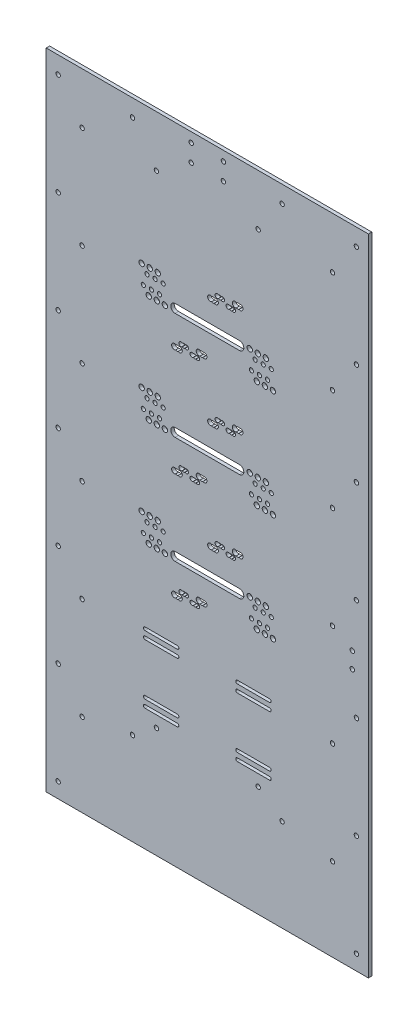
from build123d import *

# Parameters (mm, degrees)
SKETCH1_W           = 300
SKETCH1_H           = 600
BOSS_EXTRUDE1_DEPTH = 3.175
CUT_EXTRUDE1_DEPTH  = 10
SKETCH5_R           = 2.5
SKETCH5_R_2         = 1.95
CUT_EXTRUDE4_DEPTH  = 10
SKETCH6_R           = 2.05
CUT_EXTRUDE5_DEPTH  = 51
CUT_EXTRUDE6_DEPTH  = 51
SKETCH8_R           = 2.1
CUT_EXTRUDE7_DEPTH  = 67
SKETCH9_R           = 2.05
CUT_EXTRUDE8_DEPTH  = 10


with BuildPart() as part:
    # Sketch1 → Boss-Extrude1 (new body)
    with BuildSketch(Plane.XY):
        with Locations((-15.986837609, 103.602194644)):
            Rectangle(SKETCH1_W, SKETCH1_H)
    extrude(amount=BOSS_EXTRUDE1_DEPTH)

    # Sketch4 → Cut-Extrude1 (cut)
    with BuildSketch(Plane.XY.offset(3.175)):
        with BuildLine():
            Line((-45.986837609, 257.602194644), (14.013162391, 257.602194644))
            ThreePointArc((14.013162391, 257.602194644), (18.013162391, 253.602194644), (14.013162391, 249.602194644))
            Line((14.013162391, 249.602194644), (-45.986837609, 249.602194644))
            ThreePointArc((-45.986837609, 249.602194644), (-49.986837609, 253.602194644), (-45.986837609, 257.602194644))
        make_face()
        with BuildLine():
            Line((-45.986837609, 157.602194644), (14.013162391, 157.602194644))
            ThreePointArc((14.013162391, 157.602194644), (18.013162391, 153.602194644), (14.013162391, 149.602194644))
            Line((14.013162391, 149.602194644), (-45.986837609, 149.602194644))
            ThreePointArc((-45.986837609, 149.602194644), (-49.986837609, 153.602194644), (-45.986837609, 157.602194644))
        make_face()
        with BuildLine():
            Line((-45.986837609, 57.602194644), (14.013162391, 57.602194644))
            ThreePointArc((14.013162391, 57.602194644), (18.013162391, 53.602194644), (14.013162391, 49.602194644))
            Line((14.013162391, 49.602194644), (-45.986837609, 49.602194644))
            ThreePointArc((-45.986837609, 49.602194644), (-49.986837609, 53.602194644), (-45.986837609, 57.602194644))
        make_face()
    extrude(amount=-CUT_EXTRUDE1_DEPTH, mode=Mode.SUBTRACT)

    # Sketch5 → Cut-Extrude4 (cut)
    with BuildSketch(Plane(origin=(0, 0, 0), x_dir=(-1, 0, 0), z_dir=(0, 0, -1))):
        with Locations((-30.126255431, 32.82022594)):
            Circle(SKETCH5_R)
        with Locations((-37.626255431, 32.82022594)):
            Circle(SKETCH5_R)
        with Locations((-45.126255431, 32.82022594)):
            Circle(SKETCH5_R)
        with Locations((-32.60242235, 39.116594733)):
            Circle(SKETCH5_R_2)
        with Locations((-25.10242235, 39.116594733)):
            Circle(SKETCH5_R_2)
        with Locations((-40.10242235, 39.116594733)):
            Circle(SKETCH5_R_2)
        with Locations((-36.067244746, 49.474446333)):
            Circle(SKETCH5_R_2)
        with Locations((-28.567244746, 49.474446333)):
            Circle(SKETCH5_R_2)
        with Locations((-43.567244746, 49.474446333)):
            Circle(SKETCH5_R_2)
        with Locations((-38.543411665, 55.770815126)):
            Circle(SKETCH5_R)
        with Locations((-31.043411665, 55.770815126)):
            Circle(SKETCH5_R)
        with Locations((-23.543411665, 55.770815126)):
            Circle(SKETCH5_R)
        with Locations((62.09993065, 74.384163348)):
            Circle(SKETCH5_R)
        with Locations((69.59993065, 74.384163348)):
            Circle(SKETCH5_R)
        with Locations((77.09993065, 74.384163348)):
            Circle(SKETCH5_R)
        with Locations((57.076097569, 68.087794555)):
            Circle(SKETCH5_R_2)
        with Locations((64.576097569, 68.087794555)):
            Circle(SKETCH5_R_2)
        with Locations((72.076097569, 68.087794555)):
            Circle(SKETCH5_R_2)
        with Locations((60.540919965, 57.729942956)):
            Circle(SKETCH5_R_2)
        with Locations((68.040919965, 57.729942956)):
            Circle(SKETCH5_R_2)
        with Locations((75.540919965, 57.729942956)):
            Circle(SKETCH5_R_2)
        with Locations((70.517086884, 51.433574163)):
            Circle(SKETCH5_R)
        with Locations((63.017086884, 51.433574163)):
            Circle(SKETCH5_R)
        with Locations((55.517086884, 51.433574163)):
            Circle(SKETCH5_R)
        with Locations((-30.126255431, 132.82022594)):
            Circle(SKETCH5_R)
        with Locations((-37.626255431, 132.82022594)):
            Circle(SKETCH5_R)
        with Locations((-45.126255431, 132.82022594)):
            Circle(SKETCH5_R)
        with Locations((-32.60242235, 139.116594733)):
            Circle(SKETCH5_R_2)
        with Locations((-25.10242235, 139.116594733)):
            Circle(SKETCH5_R_2)
        with Locations((-40.10242235, 139.116594733)):
            Circle(SKETCH5_R_2)
        with Locations((-36.067244746, 149.474446333)):
            Circle(SKETCH5_R_2)
        with Locations((-28.567244746, 149.474446333)):
            Circle(SKETCH5_R_2)
        with Locations((-43.567244746, 149.474446333)):
            Circle(SKETCH5_R_2)
        with Locations((-38.543411665, 155.770815126)):
            Circle(SKETCH5_R)
        with Locations((-31.043411665, 155.770815126)):
            Circle(SKETCH5_R)
        with Locations((-23.543411665, 155.770815126)):
            Circle(SKETCH5_R)
        with Locations((62.09993065, 174.384163348)):
            Circle(SKETCH5_R)
        with Locations((69.59993065, 174.384163348)):
            Circle(SKETCH5_R)
        with Locations((77.09993065, 174.384163348)):
            Circle(SKETCH5_R)
        with Locations((57.076097569, 168.087794555)):
            Circle(SKETCH5_R_2)
        with Locations((64.576097569, 168.087794555)):
            Circle(SKETCH5_R_2)
        with Locations((72.076097569, 168.087794555)):
            Circle(SKETCH5_R_2)
        with Locations((60.540919965, 157.729942956)):
            Circle(SKETCH5_R_2)
        with Locations((68.040919965, 157.729942956)):
            Circle(SKETCH5_R_2)
        with Locations((75.540919965, 157.729942956)):
            Circle(SKETCH5_R_2)
        with Locations((70.517086884, 151.433574163)):
            Circle(SKETCH5_R)
        with Locations((63.017086884, 151.433574163)):
            Circle(SKETCH5_R)
        with Locations((55.517086884, 151.433574163)):
            Circle(SKETCH5_R)
        with Locations((-30.126255431, 232.82022594)):
            Circle(SKETCH5_R)
        with Locations((-37.626255431, 232.82022594)):
            Circle(SKETCH5_R)
        with Locations((-45.126255431, 232.82022594)):
            Circle(SKETCH5_R)
        with Locations((-32.60242235, 239.116594733)):
            Circle(SKETCH5_R_2)
        with Locations((-25.10242235, 239.116594733)):
            Circle(SKETCH5_R_2)
        with Locations((-40.10242235, 239.116594733)):
            Circle(SKETCH5_R_2)
        with Locations((-36.067244746, 249.474446333)):
            Circle(SKETCH5_R_2)
        with Locations((-28.567244746, 249.474446333)):
            Circle(SKETCH5_R_2)
        with Locations((-43.567244746, 249.474446333)):
            Circle(SKETCH5_R_2)
        with Locations((-38.543411665, 255.770815126)):
            Circle(SKETCH5_R)
        with Locations((-31.043411665, 255.770815126)):
            Circle(SKETCH5_R)
        with Locations((-23.543411665, 255.770815126)):
            Circle(SKETCH5_R)
        with Locations((62.09993065, 274.384163348)):
            Circle(SKETCH5_R)
        with Locations((69.59993065, 274.384163348)):
            Circle(SKETCH5_R)
        with Locations((77.09993065, 274.384163348)):
            Circle(SKETCH5_R)
        with Locations((57.076097569, 268.087794555)):
            Circle(SKETCH5_R_2)
        with Locations((64.576097569, 268.087794555)):
            Circle(SKETCH5_R_2)
        with Locations((72.076097569, 268.087794555)):
            Circle(SKETCH5_R_2)
        with Locations((60.540919965, 257.729942956)):
            Circle(SKETCH5_R_2)
        with Locations((68.040919965, 257.729942956)):
            Circle(SKETCH5_R_2)
        with Locations((75.540919965, 257.729942956)):
            Circle(SKETCH5_R_2)
        with Locations((70.517086884, 251.433574163)):
            Circle(SKETCH5_R)
        with Locations((63.017086884, 251.433574163)):
            Circle(SKETCH5_R)
        with Locations((55.517086884, 251.433574163)):
            Circle(SKETCH5_R)
        with BuildLine():
            ThreePointArc((-11.035122677, 86.887033976), (-12.285122677, 87.221970467), (-13.535122677, 86.887033976))
            ThreePointArc((-13.535122677, 86.887033976), (-17.285122677, 84.721970467), (-13.535122677, 82.556906957))
            ThreePointArc((-13.535122677, 82.556906957), (-12.285122677, 82.221970467), (-11.035122677, 82.556906957))
            ThreePointArc((-11.035122677, 82.556906957), (-7.285122677, 84.721970467), (-11.035122677, 86.887033976))
        make_face()
        with BuildLine():
            ThreePointArc((20.06032723, 26.907580641), (21.31032723, 26.572644151), (22.56032723, 26.907580641))
            ThreePointArc((22.56032723, 26.907580641), (26.31032723, 29.072644151), (22.56032723, 31.23770766))
            ThreePointArc((22.56032723, 31.23770766), (21.31032723, 31.572644151), (20.06032723, 31.23770766))
            ThreePointArc((20.06032723, 31.23770766), (16.31032723, 29.072644151), (20.06032723, 26.907580641))
        make_face()
        with BuildLine():
            ThreePointArc((26.355079811, 25.543449103), (23.155079811, 24.046786149), (26.355079811, 22.550123194))
            ThreePointArc((26.355079811, 22.550123194), (27.605079811, 22.096786149), (28.855079811, 22.550123194))
            ThreePointArc((28.855079811, 22.550123194), (32.055079811, 24.046786149), (28.855079811, 25.543449103))
            ThreePointArc((28.855079811, 25.543449103), (27.605079811, 25.996786149), (26.355079811, 25.543449103))
        make_face()
        with BuildLine():
            ThreePointArc((39.214045315, 26.011613861), (42.414045315, 27.508276815), (39.214045315, 29.00493977))
            ThreePointArc((39.214045315, 29.00493977), (37.964045315, 29.458276815), (36.714045315, 29.00493977))
            ThreePointArc((36.714045315, 29.00493977), (33.514045315, 27.508276815), (36.714045315, 26.011613861))
            ThreePointArc((36.714045315, 26.011613861), (37.964045315, 25.558276815), (39.214045315, 26.011613861))
        make_face()
        with BuildLine():
            ThreePointArc((43.008797896, 24.647482322), (39.258797896, 22.482418813), (43.008797896, 20.317355304))
            ThreePointArc((43.008797896, 20.317355304), (44.258797896, 19.982418813), (45.508797896, 20.317355304))
            ThreePointArc((45.508797896, 20.317355304), (49.258797896, 22.482418813), (45.508797896, 24.647482322))
            ThreePointArc((45.508797896, 24.647482322), (44.258797896, 24.982418813), (43.008797896, 24.647482322))
        make_face()
        with BuildLine():
            ThreePointArc((-7.240370096, 81.192775404), (-10.440370091, 79.696112456), (-7.240370096, 78.199449508))
            ThreePointArc((-7.240370096, 78.199449508), (-5.990370095, 77.746112461), (-4.740370094, 78.199449509))
            ThreePointArc((-4.740370094, 78.199449509), (-1.540370099, 79.696112464), (-4.7403701, 81.192775407))
            ThreePointArc((-4.7403701, 81.192775407), (-5.990370098, 81.646112451), (-7.240370096, 81.192775404))
        make_face()
        with BuildLine():
            ThreePointArc((3.118595408, 84.654266079), (-0.081404587, 83.157603131), (3.118595408, 81.660940183))
            ThreePointArc((3.118595408, 81.660940183), (4.368595408, 81.207603136), (5.618595408, 81.660940183))
            ThreePointArc((5.618595408, 81.660940183), (8.818595403, 83.157603131), (5.618595408, 84.654266079))
            ThreePointArc((5.618595408, 84.654266079), (4.368595408, 85.107603126), (3.118595408, 84.654266079))
        make_face()
        with BuildLine():
            ThreePointArc((9.413347989, 80.29680863), (5.663347989, 78.13174512), (9.413347989, 75.966681611))
            ThreePointArc((9.413347989, 75.966681611), (10.663347989, 75.63174512), (11.913347989, 75.966681611))
            ThreePointArc((11.913347989, 75.966681611), (15.663347989, 78.13174512), (11.913347989, 80.29680863))
            ThreePointArc((11.913347989, 80.29680863), (10.663347989, 80.63174512), (9.413347989, 80.29680863))
        make_face()
        with BuildLine():
            ThreePointArc((-11.035122677, 186.887033976), (-12.285122677, 187.221970467), (-13.535122677, 186.887033976))
            ThreePointArc((-13.535122677, 186.887033976), (-17.285122677, 184.721970467), (-13.535122677, 182.556906957))
            ThreePointArc((-13.535122677, 182.556906957), (-12.285122677, 182.221970467), (-11.035122677, 182.556906957))
            ThreePointArc((-11.035122677, 182.556906957), (-7.285122677, 184.721970467), (-11.035122677, 186.887033976))
        make_face()
        with BuildLine():
            ThreePointArc((20.06032723, 126.907580641), (21.31032723, 126.572644151), (22.56032723, 126.907580641))
            ThreePointArc((22.56032723, 126.907580641), (26.31032723, 129.072644151), (22.56032723, 131.23770766))
            ThreePointArc((22.56032723, 131.23770766), (21.31032723, 131.572644151), (20.06032723, 131.23770766))
            ThreePointArc((20.06032723, 131.23770766), (16.31032723, 129.072644151), (20.06032723, 126.907580641))
        make_face()
        with BuildLine():
            ThreePointArc((26.355079811, 125.543449103), (23.155079811, 124.046786149), (26.355079811, 122.550123194))
            ThreePointArc((26.355079811, 122.550123194), (27.605079811, 122.096786149), (28.855079811, 122.550123194))
            ThreePointArc((28.855079811, 122.550123194), (32.055079811, 124.046786149), (28.855079811, 125.543449103))
            ThreePointArc((28.855079811, 125.543449103), (27.605079811, 125.996786149), (26.355079811, 125.543449103))
        make_face()
        with BuildLine():
            ThreePointArc((39.214045315, 126.011613861), (42.414045315, 127.508276815), (39.214045315, 129.00493977))
            ThreePointArc((39.214045315, 129.00493977), (37.964045315, 129.458276815), (36.714045315, 129.00493977))
            ThreePointArc((36.714045315, 129.00493977), (33.514045315, 127.508276815), (36.714045315, 126.011613861))
            ThreePointArc((36.714045315, 126.011613861), (37.964045315, 125.558276815), (39.214045315, 126.011613861))
        make_face()
        with BuildLine():
            ThreePointArc((43.008797896, 124.647482322), (39.258797896, 122.482418813), (43.008797896, 120.317355304))
            ThreePointArc((43.008797896, 120.317355304), (44.258797896, 119.982418813), (45.508797896, 120.317355304))
            ThreePointArc((45.508797896, 120.317355304), (49.258797896, 122.482418813), (45.508797896, 124.647482322))
            ThreePointArc((45.508797896, 124.647482322), (44.258797896, 124.982418813), (43.008797896, 124.647482322))
        make_face()
        with BuildLine():
            ThreePointArc((-7.240370096, 181.192775404), (-10.440370091, 179.696112456), (-7.240370096, 178.199449508))
            ThreePointArc((-7.240370096, 178.199449508), (-5.990370095, 177.746112461), (-4.740370094, 178.199449509))
            ThreePointArc((-4.740370094, 178.199449509), (-1.540370099, 179.696112464), (-4.7403701, 181.192775407))
            ThreePointArc((-4.7403701, 181.192775407), (-5.990370098, 181.646112451), (-7.240370096, 181.192775404))
        make_face()
        with BuildLine():
            ThreePointArc((3.118595408, 184.654266079), (-0.081404587, 183.157603131), (3.118595408, 181.660940183))
            ThreePointArc((3.118595408, 181.660940183), (4.368595408, 181.207603136), (5.618595408, 181.660940183))
            ThreePointArc((5.618595408, 181.660940183), (8.818595403, 183.157603131), (5.618595408, 184.654266079))
            ThreePointArc((5.618595408, 184.654266079), (4.368595408, 185.107603126), (3.118595408, 184.654266079))
        make_face()
        with BuildLine():
            ThreePointArc((9.413347989, 180.29680863), (5.663347989, 178.13174512), (9.413347989, 175.966681611))
            ThreePointArc((9.413347989, 175.966681611), (10.663347989, 175.63174512), (11.913347989, 175.966681611))
            ThreePointArc((11.913347989, 175.966681611), (15.663347989, 178.13174512), (11.913347989, 180.29680863))
            ThreePointArc((11.913347989, 180.29680863), (10.663347989, 180.63174512), (9.413347989, 180.29680863))
        make_face()
        with BuildLine():
            ThreePointArc((-11.035122677, 286.887033976), (-12.285122677, 287.221970467), (-13.535122677, 286.887033976))
            ThreePointArc((-13.535122677, 286.887033976), (-17.285122677, 284.721970467), (-13.535122677, 282.556906957))
            ThreePointArc((-13.535122677, 282.556906957), (-12.285122677, 282.221970467), (-11.035122677, 282.556906957))
            ThreePointArc((-11.035122677, 282.556906957), (-7.285122677, 284.721970467), (-11.035122677, 286.887033976))
        make_face()
        with BuildLine():
            ThreePointArc((20.06032723, 226.907580641), (21.31032723, 226.572644151), (22.56032723, 226.907580641))
            ThreePointArc((22.56032723, 226.907580641), (26.31032723, 229.072644151), (22.56032723, 231.23770766))
            ThreePointArc((22.56032723, 231.23770766), (21.31032723, 231.572644151), (20.06032723, 231.23770766))
            ThreePointArc((20.06032723, 231.23770766), (16.31032723, 229.072644151), (20.06032723, 226.907580641))
        make_face()
        with BuildLine():
            ThreePointArc((26.355079811, 225.543449103), (23.155079811, 224.046786149), (26.355079811, 222.550123194))
            ThreePointArc((26.355079811, 222.550123194), (27.605079811, 222.096786149), (28.855079811, 222.550123194))
            ThreePointArc((28.855079811, 222.550123194), (32.055079811, 224.046786149), (28.855079811, 225.543449103))
            ThreePointArc((28.855079811, 225.543449103), (27.605079811, 225.996786149), (26.355079811, 225.543449103))
        make_face()
        with BuildLine():
            ThreePointArc((39.214045315, 226.011613861), (42.414045315, 227.508276815), (39.214045315, 229.00493977))
            ThreePointArc((39.214045315, 229.00493977), (37.964045315, 229.458276815), (36.714045315, 229.00493977))
            ThreePointArc((36.714045315, 229.00493977), (33.514045315, 227.508276815), (36.714045315, 226.011613861))
            ThreePointArc((36.714045315, 226.011613861), (37.964045315, 225.558276815), (39.214045315, 226.011613861))
        make_face()
        with BuildLine():
            ThreePointArc((43.008797896, 224.647482322), (39.258797896, 222.482418813), (43.008797896, 220.317355304))
            ThreePointArc((43.008797896, 220.317355304), (44.258797896, 219.982418813), (45.508797896, 220.317355304))
            ThreePointArc((45.508797896, 220.317355304), (49.258797896, 222.482418813), (45.508797896, 224.647482322))
            ThreePointArc((45.508797896, 224.647482322), (44.258797896, 224.982418813), (43.008797896, 224.647482322))
        make_face()
        with BuildLine():
            ThreePointArc((-7.240370096, 281.192775404), (-10.440370091, 279.696112456), (-7.240370096, 278.199449508))
            ThreePointArc((-7.240370096, 278.199449508), (-5.990370095, 277.746112461), (-4.740370094, 278.199449509))
            ThreePointArc((-4.740370094, 278.199449509), (-1.540370099, 279.696112464), (-4.7403701, 281.192775407))
            ThreePointArc((-4.7403701, 281.192775407), (-5.990370098, 281.646112451), (-7.240370096, 281.192775404))
        make_face()
        with BuildLine():
            ThreePointArc((3.118595408, 284.654266079), (-0.081404587, 283.157603131), (3.118595408, 281.660940183))
            ThreePointArc((3.118595408, 281.660940183), (4.368595408, 281.207603136), (5.618595408, 281.660940183))
            ThreePointArc((5.618595408, 281.660940183), (8.818595403, 283.157603131), (5.618595408, 284.654266079))
            ThreePointArc((5.618595408, 284.654266079), (4.368595408, 285.107603126), (3.118595408, 284.654266079))
        make_face()
        with BuildLine():
            ThreePointArc((9.413347989, 280.29680863), (5.663347989, 278.13174512), (9.413347989, 275.966681611))
            ThreePointArc((9.413347989, 275.966681611), (10.663347989, 275.63174512), (11.913347989, 275.966681611))
            ThreePointArc((11.913347989, 275.966681611), (15.663347989, 278.13174512), (11.913347989, 280.29680863))
            ThreePointArc((11.913347989, 280.29680863), (10.663347989, 280.63174512), (9.413347989, 280.29680863))
        make_face()
    extrude(amount=-CUT_EXTRUDE4_DEPTH, mode=Mode.SUBTRACT)

    # Sketch6 → Cut-Extrude5 (cut)
    with BuildSketch(Plane(origin=(0, 0, 0), x_dir=(-1, 0, 0), z_dir=(0, 0, -1))):
        with Locations((0.986837609, 394.602194644)):
            Circle(SKETCH6_R)
        with Locations((30.986837609, 394.602194644)):
            Circle(SKETCH6_R)
        with Locations((30.986837609, 378.602194644)):
            Circle(SKETCH6_R)
        with Locations((0.986837609, 378.602194644)):
            Circle(SKETCH6_R)
    extrude(amount=-CUT_EXTRUDE5_DEPTH, mode=Mode.SUBTRACT)

    # Sketch7 → Cut-Extrude6 (cut)
    with BuildSketch(Plane(origin=(0, 0, 0), x_dir=(-1, 0, 0), z_dir=(0, 0, -1))):
        with BuildLine():
            Line((-42.013162391, -24.550253951), (-12.013162391, -24.550253951))
            ThreePointArc((-12.013162391, -24.550253951), (-10.513162391, -26.050253951), (-12.013162391, -27.550253951))
            Line((-12.013162391, -27.550253951), (-42.013162391, -27.550253951))
            ThreePointArc((-42.013162391, -27.550253951), (-43.513162391, -26.050253951), (-42.013162391, -24.550253951))
        make_face()
        with BuildLine():
            Line((-42.013162391, -17.24179585), (-12.013162391, -17.24179585))
            ThreePointArc((-12.013162391, -17.24179585), (-10.513162391, -18.74179585), (-12.013162391, -20.24179585))
            Line((-12.013162391, -20.24179585), (-42.013162391, -20.24179585))
            ThreePointArc((-42.013162391, -20.24179585), (-43.513162391, -18.74179585), (-42.013162391, -17.24179585))
        make_face()
        with BuildLine():
            Line((43.986837609, -24.550253951), (73.986837609, -24.550253951))
            ThreePointArc((73.986837609, -24.550253951), (75.486837609, -26.050253951), (73.986837609, -27.550253951))
            Line((73.986837609, -27.550253951), (43.986837609, -27.550253951))
            ThreePointArc((43.986837609, -27.550253951), (42.486837609, -26.050253951), (43.986837609, -24.550253951))
        make_face()
        with BuildLine():
            Line((43.986837609, -17.24179585), (73.986837609, -17.24179585))
            ThreePointArc((73.986837609, -17.24179585), (75.486837609, -18.74179585), (73.986837609, -20.24179585))
            Line((73.986837609, -20.24179585), (43.986837609, -20.24179585))
            ThreePointArc((43.986837609, -20.24179585), (42.486837609, -18.74179585), (43.986837609, -17.24179585))
        make_face()
        with BuildLine():
            Line((43.986837609, -79.858712053), (73.986837609, -79.858712053))
            ThreePointArc((73.986837609, -79.858712053), (75.486837609, -81.358712053), (73.986837609, -82.858712053))
            Line((73.986837609, -82.858712053), (43.986837609, -82.858712053))
            ThreePointArc((43.986837609, -82.858712053), (42.486837609, -81.358712053), (43.986837609, -79.858712053))
        make_face()
        with BuildLine():
            Line((43.986837609, -72.550253951), (73.986837609, -72.550253951))
            ThreePointArc((73.986837609, -72.550253951), (75.486837609, -74.050253951), (73.986837609, -75.550253951))
            Line((73.986837609, -75.550253951), (43.986837609, -75.550253951))
            ThreePointArc((43.986837609, -75.550253951), (42.486837609, -74.050253951), (43.986837609, -72.550253951))
        make_face()
        with BuildLine():
            Line((-42.013162391, -79.858712053), (-12.013162391, -79.858712053))
            ThreePointArc((-12.013162391, -79.858712053), (-10.513162391, -81.358712053), (-12.013162391, -82.858712053))
            Line((-12.013162391, -82.858712053), (-42.013162391, -82.858712053))
            ThreePointArc((-42.013162391, -82.858712053), (-43.513162391, -81.358712053), (-42.013162391, -79.858712053))
        make_face()
        with BuildLine():
            Line((-42.013162391, -72.550253951), (-12.013162391, -72.550253951))
            ThreePointArc((-12.013162391, -72.550253951), (-10.513162391, -74.050253951), (-12.013162391, -75.550253951))
            Line((-12.013162391, -75.550253951), (-42.013162391, -75.550253951))
            ThreePointArc((-42.013162391, -75.550253951), (-43.513162391, -74.050253951), (-42.013162391, -72.550253951))
        make_face()
    extrude(amount=-CUT_EXTRUDE6_DEPTH, mode=Mode.SUBTRACT)

    # Sketch8 → Cut-Extrude7 (cut)
    with BuildSketch(Plane(origin=(0, 0, 0), x_dir=(-1, 0, 0), z_dir=(0, 0, -1))):
        with Locations((-119.013162391, 60.107185306)):
            Circle(SKETCH8_R)
        with Locations((-119.013162391, 45.107185306)):
            Circle(SKETCH8_R)
    extrude(amount=-CUT_EXTRUDE7_DEPTH, mode=Mode.SUBTRACT)

    # Sketch9 → Cut-Extrude8 (cut)
    with BuildSketch(Plane(origin=(0, 0, 0), x_dir=(-1, 0, 0), z_dir=(0, 0, -1))):
        with Locations((-122.874578489, 387.723317654)):
            Circle(SKETCH9_R)
        with Locations((-100.597410687, 355.965563673)):
            Circle(SKETCH9_R)
        with Locations((-53.648179996, 387.723317654)):
            Circle(SKETCH9_R)
        with Locations((-31.371012194, 355.965563673)):
            Circle(SKETCH9_R)
        with Locations((-122.874578489, 292.723317654)):
            Circle(SKETCH9_R)
        with Locations((-100.597410687, 260.965563673)):
            Circle(SKETCH9_R)
        with Locations((-122.874578489, 197.723317654)):
            Circle(SKETCH9_R)
        with Locations((-100.597410687, 165.965563673)):
            Circle(SKETCH9_R)
        with Locations((-122.874578489, 102.723317654)):
            Circle(SKETCH9_R)
        with Locations((-100.597410687, 70.965563673)):
            Circle(SKETCH9_R)
        with Locations((-122.874578489, 7.723317654)):
            Circle(SKETCH9_R)
        with Locations((-100.597410687, -24.034436327)):
            Circle(SKETCH9_R)
        with Locations((-122.874578489, -87.276682346)):
            Circle(SKETCH9_R)
        with Locations((-100.597410687, -119.034436327)):
            Circle(SKETCH9_R)
        with Locations((-122.874578489, -182.276682346)):
            Circle(SKETCH9_R)
        with Locations((-100.597410687, -214.034436327)):
            Circle(SKETCH9_R)
        with Locations((-53.648179996, -110.280999066)):
            Circle(SKETCH9_R)
        with Locations((-31.371012194, -93.41118932)):
            Circle(SKETCH9_R)
        with Locations((63.344687413, -93.41118932)):
            Circle(SKETCH9_R)
        with Locations((85.621855215, -110.280999066)):
            Circle(SKETCH9_R)
        with Locations((132.571085906, -214.034436327)):
            Circle(SKETCH9_R)
        with Locations((154.848253708, -182.276682346)):
            Circle(SKETCH9_R)
        with Locations((132.571085906, -119.034436327)):
            Circle(SKETCH9_R)
        with Locations((154.848253708, -87.276682346)):
            Circle(SKETCH9_R)
        with Locations((132.571085906, -24.034436327)):
            Circle(SKETCH9_R)
        with Locations((154.848253708, 7.723317654)):
            Circle(SKETCH9_R)
        with Locations((132.571085906, 70.965563673)):
            Circle(SKETCH9_R)
        with Locations((154.848253708, 102.723317654)):
            Circle(SKETCH9_R)
        with Locations((132.571085906, 165.965563673)):
            Circle(SKETCH9_R)
        with Locations((154.848253708, 197.723317654)):
            Circle(SKETCH9_R)
        with Locations((132.571085906, 260.965563673)):
            Circle(SKETCH9_R)
        with Locations((154.848253708, 292.723317654)):
            Circle(SKETCH9_R)
        with Locations((63.344687413, 355.965563673)):
            Circle(SKETCH9_R)
        with Locations((85.621855215, 387.723317654)):
            Circle(SKETCH9_R)
        with Locations((132.571085906, 355.965563673)):
            Circle(SKETCH9_R)
        with Locations((154.848253708, 387.723317654)):
            Circle(SKETCH9_R)
    extrude(amount=-CUT_EXTRUDE8_DEPTH, mode=Mode.SUBTRACT)


solid = part.part
